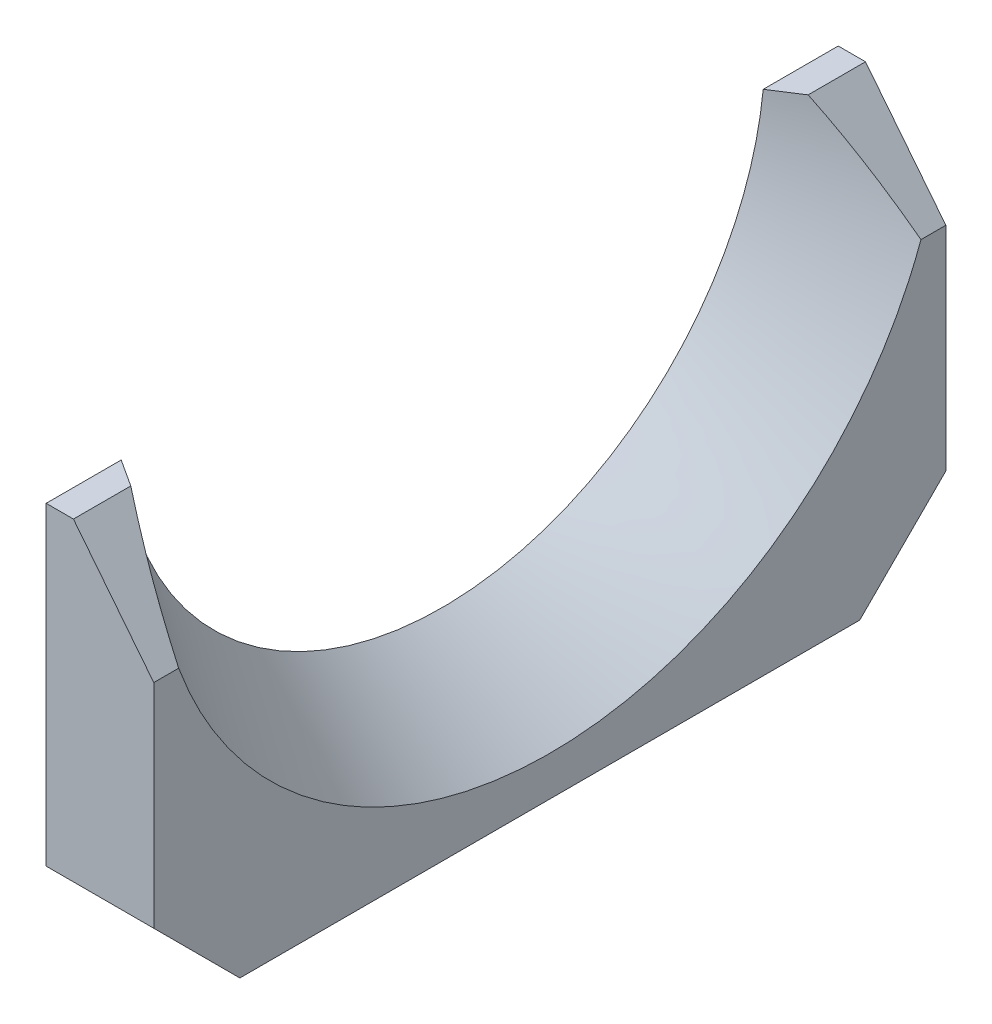
from build123d import *

# Parameters (mm, degrees)
BOSS_EXTRUDE1_DEPTH     = 46
CUT_EXTRUDE1_DEPTH      = 113.313178374
CHAMFER1_SIZE           = 10
CUT_EXTRUDE2_DEPTH      = 106.690586293
CUT_EXTRUDE2_DEPTH_BACK = 106.690586293
SKETCH5_W               = 3.168316832
SKETCH5_H               = 4


with BuildPart() as part:
    # Sketch1 → Boss-Extrude1 (new, symmetric)
    with BuildSketch(Plane.XY):
        Polygon((0, 0), (40, 0), (0, 50.5), align=None)
    extrude(amount=BOSS_EXTRUDE1_DEPTH, both=True)

    # Cut-Loft1: read off the stored shape, not the designer's step
    # Cut-Loft1: loft between two sections, ruled curve by curve
    cut_loft1_from = [
        Edge.make_bspline([(0, 87.819982257, -3.673389342), (0, 88.152798689, -0.291487961), (0, 88.022862533, 3.13586039), (0, 86.913116995, 9.45832515), (0, 85.146489417, 15.281995192), (0, 80.482269823, 23.129239399), (0, 74.07599018, 29.632605234), (0, 68.891494438, 32.819627302), (0, 63.05780063, 35.497893971), (0, 56.493578605, 37.489222603), (0, 46.206217119, 37.721421955), (0, 36.234588822, 35.183081039), (0, 27.310758236, 30.060050466), (0, 20.090332485, 22.728908224), (0, 15.103972214, 13.728199544), (0, 12.717265155, 3.718836313), (0, 12.977137467, -3.13586039), (0, 14.086883005, -9.45832515), (0, 15.853510583, -15.281995192), (0, 20.517730177, -23.129239399), (0, 26.92400982, -29.632605234), (0, 32.108505562, -32.819627302), (0, 37.94219937, -35.497893971), (0, 44.506421395, -37.489222603), (0, 54.793782881, -37.721421955), (0, 64.765411178, -35.183081039), (0, 73.689241764, -30.060050466), (0, 80.909667515, -22.728908224), (0, 85.896027786, -13.728199544), (0, 87.487165825, -7.055290723), (0, 87.819982257, -3.673389342)], [0.302884615, 0.302884615, 0.302884615, 0.302884615, 0.346153846, 0.346153846, 0.384615385, 0.423076923, 0.461538462, 0.5, 0.5, 0.543269231, 0.586538462, 0.629807692, 0.673076923, 0.716346154, 0.759615385, 0.802884615, 0.846153846, 0.846153846, 0.884615385, 0.923076923, 0.961538462, 1, 1, 1.043269231, 1.086538462, 1.129807692, 1.173076923, 1.216346154, 1.259615385, 1.302884615, 1.302884615, 1.302884615, 1.302884615], 3),
    ]
    cut_loft1_to = [
        Edge.make_bspline([(25, 104.882230946, 8.223529932), (25, 104.136933431, 13.151573537), (25, 102.717354983, 17.977504325), (25, 98.861671081, 26.566476385), (25, 94.251793354, 34.209630574), (25, 84.793260692, 43.685771848), (25, 73.342186447, 50.623638392), (25, 64.823003498, 53.286775734), (25, 55.564139969, 54.99270233), (25, 45.514164495, 55.458788951), (25, 30.804709403, 52.082462001), (25, 17.542342514, 44.880945638), (25, 6.700897593, 34.382224999), (25, -0.923210446, 21.357900078), (25, -4.769561623, 6.764826515), (25, -4.55651188, -8.325642749), (25, -1.717354983, -17.977504325), (25, 2.138328919, -26.566476385), (25, 6.748206646, -34.209630574), (25, 16.206739308, -43.685771848), (25, 27.657813553, -50.623638392), (25, 36.176996502, -53.286775734), (25, 45.435860031, -54.99270233), (25, 55.485835505, -55.458788951), (25, 70.195290597, -52.082462001), (25, 83.457657486, -44.880945638), (25, 94.299102407, -34.382224999), (25, 101.923210446, -21.357900078), (25, 105.769561623, -6.764826515), (25, 105.627528461, 3.295486328), (25, 104.882230946, 8.223529932)], [0.302884615, 0.302884615, 0.302884615, 0.302884615, 0.346153846, 0.346153846, 0.384615385, 0.423076923, 0.461538462, 0.5, 0.5, 0.543269231, 0.586538462, 0.629807692, 0.673076923, 0.716346154, 0.759615385, 0.802884615, 0.846153846, 0.846153846, 0.884615385, 0.923076923, 0.961538462, 1, 1, 1.043269231, 1.086538462, 1.129807692, 1.173076923, 1.216346154, 1.259615385, 1.302884615, 1.302884615, 1.302884615, 1.302884615], 3),
    ]
    cut_loft1 = Solid(Shell([*[Face.make_surface_from_curves(cut_loft1_from[k], cut_loft1_to[k]) for k in range(1)], Face(Wire(cut_loft1_from)), Face(Wire(cut_loft1_to))]))
    add(cut_loft1, mode=Mode.SUBTRACT)

    # Sketch4 → Cut-Extrude1 (cut, through all)
    with BuildSketch(Plane.XY.offset(46)):
        Polygon((40, 0), (12.5, 34.71875), (12.5, 0), align=None)
    extrude(amount=-CUT_EXTRUDE1_DEPTH, mode=Mode.SUBTRACT)

    # Chamfer1
    chamfer1_edges = [part.edges().sort_by_distance(p)[0] for p in [
        (6.25, 0, -46),
        (6.25, 0, 46),
    ]]
    chamfer(chamfer1_edges, length=CHAMFER1_SIZE)

    # Sketch5 → Cut-Extrude2 (cut, two sides: drawn at the far end of the back side and taken through both)
    with BuildSketch(Plane.XY.offset(46).offset(-CUT_EXTRUDE2_DEPTH_BACK)):
        with Locations((1.584158416, 48.5)):
            Rectangle(SKETCH5_W, SKETCH5_H)
    extrude(amount=CUT_EXTRUDE2_DEPTH + CUT_EXTRUDE2_DEPTH_BACK, mode=Mode.SUBTRACT)


solid = part.part
